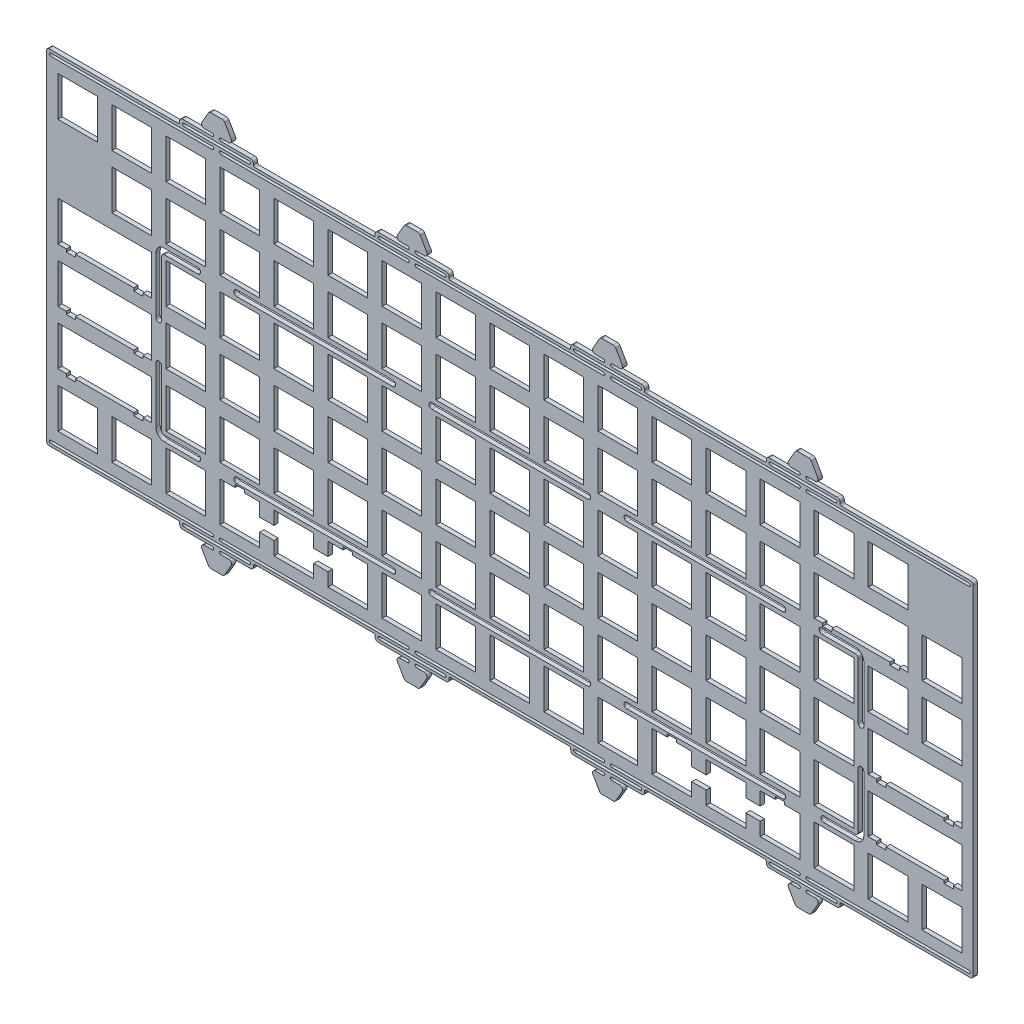
from build123d import *

# Parameters (mm, degrees)
SKETCH2_W           = 344.79935
SKETCH2_H           = 139.24936
SKETCH2_W_2         = 13.999
SKETCH2_H_2         = 14.00086
SKETCH2_W_3         = 14.001
SKETCH2_W_4         = 13.9993
SKETCH2_W_5         = 13.99955
SKETCH2_H_3         = 13.9994
SKETCH2_W_6         = 14.0007
SKETCH2_H_4         = 13.9993
SKETCH2_H_5         = 13.9992
BOSS_EXTRUDE1_DEPTH = 1.524
SKETCH3_W           = 388.73179045
SKETCH3_H           = 165.989329794
CUT_EXTRUDE1_DEPTH  = 186.935149558


with BuildPart() as part:
    # Sketch2 → Boss-Extrude1 (new body)
    with BuildSketch(Plane.XY):
        with Locations((-0.0007173, 0.0004735)):
            Rectangle(SKETCH2_W, SKETCH2_H)
        Polygon((102.2489577, -54.6242065), (102.2489577, -40.6233465), (96.8999577, -40.6233465), (96.8999577, -39.6545865), (93.5999577, -39.6545865), (93.5999577, -40.6233465), (88.2499577, -40.6233465), (88.2499577, -45.3238165), (83.1989577, -45.3238165), (83.1989577, -40.6233465), (69.1999577, -40.6233465), (69.1999577, -45.3238165), (64.1489577, -45.3238165), (64.1489577, -40.6233465), (58.8009577, -40.6233465), (58.8009577, -39.6545865), (55.4999577, -39.6545865), (55.4999577, -40.6233465), (50.1499577, -40.6233465), (50.1499577, -54.6242065), (64.1489577, -54.6242065), (64.1489577, -49.9223065), (69.1999577, -49.9223065), (69.1999577, -54.6242065), (83.1989577, -54.6242065), (83.1989577, -49.9223065), (88.2499577, -49.9223065), (88.2499577, -54.6242065), align=None, mode=Mode.SUBTRACT)
        Polygon((-50.1496423, -54.6242065), (-50.1496423, -40.6233465), (-55.4991423, -40.6233465), (-55.4991423, -39.6545865), (-58.7994423, -39.6545865), (-58.7994423, -40.6233465), (-64.1503423, -40.6233465), (-64.1503423, -45.3238165), (-69.2010423, -45.3238165), (-69.2010423, -40.6233465), (-83.2003423, -40.6233465), (-83.2003423, -45.3238165), (-88.2496423, -45.3238165), (-88.2496423, -40.6233465), (-93.6003423, -40.6233465), (-93.6003423, -39.6545865), (-96.9003423, -39.6545865), (-96.9003423, -40.6233465), (-102.2503423, -40.6233465), (-102.2503423, -54.6242065), (-88.2496423, -54.6242065), (-88.2496423, -49.9223065), (-83.2003423, -49.9223065), (-83.2003423, -54.6242065), (-69.2010423, -54.6242065), (-69.2010423, -49.9223065), (-64.1503423, -49.9223065), (-64.1503423, -54.6242065), align=None, mode=Mode.SUBTRACT)
        with Locations((152.3994577, -47.6237765)):
            Rectangle(SKETCH2_W_2, SKETCH2_H_2, mode=Mode.SUBTRACT)
        with Locations((133.3494577, -47.6237765)):
            Rectangle(SKETCH2_W_2, SKETCH2_H_2, mode=Mode.SUBTRACT)
        with Locations((114.2994577, -47.6237765)):
            Rectangle(SKETCH2_W_2, SKETCH2_H_2, mode=Mode.SUBTRACT)
        with Locations((38.0994577, -47.6237765)):
            Rectangle(SKETCH2_W_2, SKETCH2_H_2, mode=Mode.SUBTRACT)
        with Locations((19.0494577, -47.6237765)):
            Rectangle(SKETCH2_W_2, SKETCH2_H_2, mode=Mode.SUBTRACT)
        with Locations((-0.0005423, -47.6237765)):
            Rectangle(SKETCH2_W_2, SKETCH2_H_2, mode=Mode.SUBTRACT)
        with Locations((-19.0505423, -47.6237765)):
            Rectangle(SKETCH2_W_2, SKETCH2_H_2, mode=Mode.SUBTRACT)
        with Locations((-38.1015423, -47.6237765)):
            Rectangle(SKETCH2_W_3, SKETCH2_H_2, mode=Mode.SUBTRACT)
        with Locations((-114.3006923, -47.6237765)):
            Rectangle(SKETCH2_W_4, SKETCH2_H_2, mode=Mode.SUBTRACT)
        with Locations((-133.3506923, -47.6237765)):
            Rectangle(SKETCH2_W_4, SKETCH2_H_2, mode=Mode.SUBTRACT)
        with Locations((-152.4006173, -47.6237765)):
            Rectangle(SKETCH2_W_5, SKETCH2_H_2, mode=Mode.SUBTRACT)
        Polygon((126.3499577, -21.5748465), (126.3499577, -35.5742465), (129.3249577, -35.5742465), (129.3249577, -36.5443465), (132.6239577, -36.5443465), (132.6239577, -35.5742465), (153.1249577, -35.5742465), (153.1249577, -36.5443465), (156.4239577, -36.5443465), (156.4239577, -35.5742465), (159.3989577, -35.5742465), (159.3989577, -21.5748465), align=None, mode=Mode.SUBTRACT)
        Polygon((-159.4003923, -21.5748465), (-159.4003923, -35.5742465), (-156.4252023, -35.5742465), (-156.4252023, -36.5443465), (-153.1262023, -36.5443465), (-153.1262023, -35.5742465), (-132.6251423, -35.5742465), (-132.6251423, -36.5443465), (-129.3260423, -36.5443465), (-129.3260423, -35.5742465), (-126.3510423, -35.5742465), (-126.3510423, -21.5748465), align=None, mode=Mode.SUBTRACT)
        with Locations((114.2994577, -28.5745465)):
            Rectangle(SKETCH2_W_2, SKETCH2_H_3, mode=Mode.SUBTRACT)
        with Locations((95.2494577, -28.5745465)):
            Rectangle(SKETCH2_W_2, SKETCH2_H_3, mode=Mode.SUBTRACT)
        with Locations((76.1994577, -28.5745465)):
            Rectangle(SKETCH2_W_2, SKETCH2_H_3, mode=Mode.SUBTRACT)
        with Locations((57.1494577, -28.5745465)):
            Rectangle(SKETCH2_W_2, SKETCH2_H_3, mode=Mode.SUBTRACT)
        with Locations((38.0994577, -28.5745465)):
            Rectangle(SKETCH2_W_2, SKETCH2_H_3, mode=Mode.SUBTRACT)
        with Locations((19.0494577, -28.5745465)):
            Rectangle(SKETCH2_W_2, SKETCH2_H_3, mode=Mode.SUBTRACT)
        with Locations((-0.0005423, -28.5745465)):
            Rectangle(SKETCH2_W_2, SKETCH2_H_3, mode=Mode.SUBTRACT)
        with Locations((-19.0505423, -28.5745465)):
            Rectangle(SKETCH2_W_2, SKETCH2_H_3, mode=Mode.SUBTRACT)
        with Locations((-38.1015423, -28.5745465)):
            Rectangle(SKETCH2_W_3, SKETCH2_H_3, mode=Mode.SUBTRACT)
        with Locations((-57.1513923, -28.5745465)):
            Rectangle(SKETCH2_W_6, SKETCH2_H_3, mode=Mode.SUBTRACT)
        with Locations((-76.2006923, -28.5745465)):
            Rectangle(SKETCH2_W_4, SKETCH2_H_3, mode=Mode.SUBTRACT)
        with Locations((-95.2506923, -28.5745465)):
            Rectangle(SKETCH2_W_4, SKETCH2_H_3, mode=Mode.SUBTRACT)
        with Locations((-114.3006923, -28.5745465)):
            Rectangle(SKETCH2_W_4, SKETCH2_H_3, mode=Mode.SUBTRACT)
        Polygon((126.3499577, -2.5247465), (126.3499577, -16.5240465), (129.3249577, -16.5240465), (129.3249577, -17.4942465), (132.6239577, -17.4942465), (132.6239577, -16.5240465), (153.1249577, -16.5240465), (153.1249577, -17.4942465), (156.4239577, -17.4942465), (156.4239577, -16.5240465), (159.3989577, -16.5240465), (159.3989577, -2.5247465), align=None, mode=Mode.SUBTRACT)
        Polygon((-159.4003923, -2.5247465), (-159.4003923, -16.5240465), (-156.4252023, -16.5240465), (-156.4252023, -17.4942465), (-153.1262023, -17.4942465), (-153.1262023, -16.5240465), (-132.6251423, -16.5240465), (-132.6251423, -17.4942465), (-129.3260423, -17.4942465), (-129.3260423, -16.5240465), (-126.3510423, -16.5240465), (-126.3510423, -2.5247465), align=None, mode=Mode.SUBTRACT)
        with Locations((114.2994577, -9.5243965)):
            Rectangle(SKETCH2_W_2, SKETCH2_H_4, mode=Mode.SUBTRACT)
        with Locations((95.2494577, -9.5243965)):
            Rectangle(SKETCH2_W_2, SKETCH2_H_4, mode=Mode.SUBTRACT)
        with Locations((76.1994577, -9.5243965)):
            Rectangle(SKETCH2_W_2, SKETCH2_H_4, mode=Mode.SUBTRACT)
        with Locations((57.1494577, -9.5243965)):
            Rectangle(SKETCH2_W_2, SKETCH2_H_4, mode=Mode.SUBTRACT)
        with Locations((38.0994577, -9.5243965)):
            Rectangle(SKETCH2_W_2, SKETCH2_H_4, mode=Mode.SUBTRACT)
        with Locations((19.0494577, -9.5243965)):
            Rectangle(SKETCH2_W_2, SKETCH2_H_4, mode=Mode.SUBTRACT)
        with Locations((-0.0005423, -9.5243965)):
            Rectangle(SKETCH2_W_2, SKETCH2_H_4, mode=Mode.SUBTRACT)
        with Locations((-19.0505423, -9.5243965)):
            Rectangle(SKETCH2_W_2, SKETCH2_H_4, mode=Mode.SUBTRACT)
        with Locations((-38.1015423, -9.5243965)):
            Rectangle(SKETCH2_W_3, SKETCH2_H_4, mode=Mode.SUBTRACT)
        with Locations((-57.1513923, -9.5243965)):
            Rectangle(SKETCH2_W_6, SKETCH2_H_4, mode=Mode.SUBTRACT)
        with Locations((-76.2006923, -9.5243965)):
            Rectangle(SKETCH2_W_4, SKETCH2_H_4, mode=Mode.SUBTRACT)
        with Locations((-95.2506923, -9.5243965)):
            Rectangle(SKETCH2_W_4, SKETCH2_H_4, mode=Mode.SUBTRACT)
        with Locations((-114.3006923, -9.5243965)):
            Rectangle(SKETCH2_W_4, SKETCH2_H_4, mode=Mode.SUBTRACT)
        Polygon((-159.4003923, 16.5252535), (-159.4003923, 2.5259535), (-156.4252023, 2.5259535), (-156.4252023, 1.5557535), (-153.1262023, 1.5557535), (-153.1262023, 2.5259535), (-132.6251423, 2.5259535), (-132.6251423, 1.5557535), (-129.3260423, 1.5557535), (-129.3260423, 2.5259535), (-126.3510423, 2.5259535), (-126.3510423, 16.5252535), align=None, mode=Mode.SUBTRACT)
        with Locations((152.3994577, 9.5256035)):
            Rectangle(SKETCH2_W_2, SKETCH2_H_4, mode=Mode.SUBTRACT)
        with Locations((133.3494577, 9.5256035)):
            Rectangle(SKETCH2_W_2, SKETCH2_H_4, mode=Mode.SUBTRACT)
        with Locations((114.2994577, 9.5256035)):
            Rectangle(SKETCH2_W_2, SKETCH2_H_4, mode=Mode.SUBTRACT)
        with Locations((95.2494577, 9.5256035)):
            Rectangle(SKETCH2_W_2, SKETCH2_H_4, mode=Mode.SUBTRACT)
        with Locations((76.1994577, 9.5256035)):
            Rectangle(SKETCH2_W_2, SKETCH2_H_4, mode=Mode.SUBTRACT)
        with Locations((57.1494577, 9.5256035)):
            Rectangle(SKETCH2_W_2, SKETCH2_H_4, mode=Mode.SUBTRACT)
        with Locations((38.0994577, 9.5256035)):
            Rectangle(SKETCH2_W_2, SKETCH2_H_4, mode=Mode.SUBTRACT)
        with Locations((19.0494577, 9.5256035)):
            Rectangle(SKETCH2_W_2, SKETCH2_H_4, mode=Mode.SUBTRACT)
        with Locations((-0.0005423, 9.5256035)):
            Rectangle(SKETCH2_W_2, SKETCH2_H_4, mode=Mode.SUBTRACT)
        with Locations((-19.0505423, 9.5256035)):
            Rectangle(SKETCH2_W_2, SKETCH2_H_4, mode=Mode.SUBTRACT)
        with Locations((-38.1015423, 9.5256035)):
            Rectangle(SKETCH2_W_3, SKETCH2_H_4, mode=Mode.SUBTRACT)
        with Locations((-57.1513923, 9.5256035)):
            Rectangle(SKETCH2_W_6, SKETCH2_H_4, mode=Mode.SUBTRACT)
        with Locations((-76.2006923, 9.5256035)):
            Rectangle(SKETCH2_W_4, SKETCH2_H_4, mode=Mode.SUBTRACT)
        with Locations((-95.2506923, 9.5256035)):
            Rectangle(SKETCH2_W_4, SKETCH2_H_4, mode=Mode.SUBTRACT)
        with Locations((-114.3006923, 9.5256035)):
            Rectangle(SKETCH2_W_4, SKETCH2_H_4, mode=Mode.SUBTRACT)
        Polygon((107.2999577, 35.5752535), (107.2999577, 21.5759535), (110.2749577, 21.5759535), (110.2749577, 20.6057535), (113.5739577, 20.6057535), (113.5739577, 21.5759535), (134.0749577, 21.5759535), (134.0749577, 20.6057535), (137.3739577, 20.6057535), (137.3739577, 21.5759535), (140.3489577, 21.5759535), (140.3489577, 35.5752535), align=None, mode=Mode.SUBTRACT)
        with Locations((152.3994577, 28.5756035)):
            Rectangle(SKETCH2_W_2, SKETCH2_H_4, mode=Mode.SUBTRACT)
        with Locations((95.2494577, 28.5756035)):
            Rectangle(SKETCH2_W_2, SKETCH2_H_4, mode=Mode.SUBTRACT)
        with Locations((76.1994577, 28.5756035)):
            Rectangle(SKETCH2_W_2, SKETCH2_H_4, mode=Mode.SUBTRACT)
        with Locations((57.1494577, 28.5756035)):
            Rectangle(SKETCH2_W_2, SKETCH2_H_4, mode=Mode.SUBTRACT)
        with Locations((38.0994577, 28.5756035)):
            Rectangle(SKETCH2_W_2, SKETCH2_H_4, mode=Mode.SUBTRACT)
        with Locations((19.0494577, 28.5756035)):
            Rectangle(SKETCH2_W_2, SKETCH2_H_4, mode=Mode.SUBTRACT)
        with Locations((-0.0005423, 28.5756035)):
            Rectangle(SKETCH2_W_2, SKETCH2_H_4, mode=Mode.SUBTRACT)
        with Locations((-19.0505423, 28.5756035)):
            Rectangle(SKETCH2_W_2, SKETCH2_H_4, mode=Mode.SUBTRACT)
        with Locations((-38.1015423, 28.5756035)):
            Rectangle(SKETCH2_W_3, SKETCH2_H_4, mode=Mode.SUBTRACT)
        with Locations((-57.1513923, 28.5756035)):
            Rectangle(SKETCH2_W_6, SKETCH2_H_4, mode=Mode.SUBTRACT)
        with Locations((-76.2006923, 28.5756035)):
            Rectangle(SKETCH2_W_4, SKETCH2_H_4, mode=Mode.SUBTRACT)
        with Locations((-95.2506923, 28.5756035)):
            Rectangle(SKETCH2_W_4, SKETCH2_H_4, mode=Mode.SUBTRACT)
        with Locations((-114.3006923, 28.5756035)):
            Rectangle(SKETCH2_W_4, SKETCH2_H_4, mode=Mode.SUBTRACT)
        with Locations((-133.3506923, 28.5756035)):
            Rectangle(SKETCH2_W_4, SKETCH2_H_4, mode=Mode.SUBTRACT)
        with Locations((133.3494577, 47.6255535)):
            Rectangle(SKETCH2_W_2, SKETCH2_H_5, mode=Mode.SUBTRACT)
        with Locations((114.2994577, 47.6255535)):
            Rectangle(SKETCH2_W_2, SKETCH2_H_5, mode=Mode.SUBTRACT)
        with Locations((95.2494577, 47.6255535)):
            Rectangle(SKETCH2_W_2, SKETCH2_H_5, mode=Mode.SUBTRACT)
        with Locations((76.1994577, 47.6255535)):
            Rectangle(SKETCH2_W_2, SKETCH2_H_5, mode=Mode.SUBTRACT)
        with Locations((57.1494577, 47.6255535)):
            Rectangle(SKETCH2_W_2, SKETCH2_H_5, mode=Mode.SUBTRACT)
        with Locations((38.0994577, 47.6255535)):
            Rectangle(SKETCH2_W_2, SKETCH2_H_5, mode=Mode.SUBTRACT)
        with Locations((19.0494577, 47.6255535)):
            Rectangle(SKETCH2_W_2, SKETCH2_H_5, mode=Mode.SUBTRACT)
        with Locations((-0.0005423, 47.6255535)):
            Rectangle(SKETCH2_W_2, SKETCH2_H_5, mode=Mode.SUBTRACT)
        with Locations((-19.0505423, 47.6255535)):
            Rectangle(SKETCH2_W_2, SKETCH2_H_5, mode=Mode.SUBTRACT)
        with Locations((-38.1015423, 47.6255535)):
            Rectangle(SKETCH2_W_3, SKETCH2_H_5, mode=Mode.SUBTRACT)
        with Locations((-57.1513923, 47.6255535)):
            Rectangle(SKETCH2_W_6, SKETCH2_H_5, mode=Mode.SUBTRACT)
        with Locations((-76.2006923, 47.6255535)):
            Rectangle(SKETCH2_W_4, SKETCH2_H_5, mode=Mode.SUBTRACT)
        with Locations((-95.2506923, 47.6255535)):
            Rectangle(SKETCH2_W_4, SKETCH2_H_5, mode=Mode.SUBTRACT)
        with Locations((-114.3006923, 47.6255535)):
            Rectangle(SKETCH2_W_4, SKETCH2_H_5, mode=Mode.SUBTRACT)
        with Locations((-133.3506923, 47.6255535)):
            Rectangle(SKETCH2_W_4, SKETCH2_H_5, mode=Mode.SUBTRACT)
        with Locations((-152.4006173, 47.6255535)):
            Rectangle(SKETCH2_W_5, SKETCH2_H_5, mode=Mode.SUBTRACT)
    extrude(amount=BOSS_EXTRUDE1_DEPTH)

    # Sketch3 → Cut-Extrude1 (cut, through all)
    # profile 1 of 29: a face of its own
    with BuildSketch(Plane.XY.offset(1.524)):
        Rectangle(SKETCH3_W, SKETCH3_H)
        with BuildLine():
            ThreePointArc((-105.4405223, -69.6242065), (-105.9405223, -69.490231904), (-106.306547704, -69.1242065))
            Line((-106.306547704, -69.1242065), (-108.615948781, -65.1242065))
            ThreePointArc((-108.615948781, -65.1242065), (-108.615948781, -64.1242065), (-107.749923377, -63.6242065))
            Line((-107.749923377, -63.6242065), (-104.9405223, -63.6242065))
            ThreePointArc((-104.9405223, -63.6242065), (-104.4405223, -63.1242065), (-104.9405223, -62.6242065))
            Line((-104.9405223, -62.6242065), (-115.4405223, -62.6242065))
            ThreePointArc((-115.4405223, -62.6242065), (-116.147629081, -62.331313281), (-116.4405223, -61.6242065))
            Line((-116.4405223, -61.6242065), (-116.4405223, -61.1241965))
            ThreePointArc((-116.4405223, -61.1241965), (-116.58696598, -60.77065018), (-116.9405123, -60.6242065))
            Line((-116.9405123, -60.6242065), (-162.4003923, -60.6242065))
            ThreePointArc((-162.4003923, -60.6242065), (-163.107499081, -60.331313281), (-163.4003923, -59.6242065))
            Line((-163.4003923, -59.6242065), (-163.4003923, 59.6242065))
            ThreePointArc((-163.4003923, 59.6242065), (-163.107499081, 60.331313281), (-162.4003923, 60.6242065))
            Line((-162.4003923, 60.6242065), (-116.9405123, 60.6242065))
            ThreePointArc((-116.9405123, 60.6242065), (-116.58696598, 60.77065018), (-116.4405223, 61.1241965))
            Line((-116.4405223, 61.1241965), (-116.4405223, 61.6242065))
            ThreePointArc((-116.4405223, 61.6242065), (-116.147629081, 62.331313281), (-115.4405223, 62.6242065))
            Line((-115.4405223, 62.6242065), (-104.9405223, 62.6242065))
            ThreePointArc((-104.9405223, 62.6242065), (-104.4405223, 63.1242065), (-104.9405223, 63.6242065))
            Line((-104.9405223, 63.6242065), (-107.749923377, 63.6242065))
            ThreePointArc((-107.749923377, 63.6242065), (-108.615948781, 64.1242065), (-108.615948781, 65.1242065))
            Line((-108.615948781, 65.1242065), (-106.306547704, 69.1242065))
            ThreePointArc((-106.306547704, 69.1242065), (-105.9405223, 69.490231904), (-105.4405223, 69.6242065))
            Line((-105.4405223, 69.6242065), (-101.4405223, 69.6242065))
            ThreePointArc((-101.4405223, 69.6242065), (-100.9405223, 69.490231904), (-100.574496896, 69.1242065))
            Line((-100.574496896, 69.1242065), (-98.265095819, 65.1242065))
            ThreePointArc((-98.265095819, 65.1242065), (-98.265095819, 64.1242065), (-99.131121223, 63.6242065))
            Line((-99.131121223, 63.6242065), (-101.9405223, 63.6242065))
            ThreePointArc((-101.9405223, 63.6242065), (-102.4405223, 63.1242065), (-101.9405223, 62.6242065))
            Line((-101.9405223, 62.6242065), (-91.4405223, 62.6242065))
            ThreePointArc((-91.4405223, 62.6242065), (-90.733415519, 62.331313281), (-90.4405223, 61.6242065))
            Line((-90.4405223, 61.6242065), (-90.4405223, 61.1241965))
            ThreePointArc((-90.4405223, 61.1241965), (-90.29407862, 60.77065018), (-89.9405323, 60.6242065))
            Line((-89.9405323, 60.6242065), (-47.9806423, 60.6242065))
            ThreePointArc((-47.9806423, 60.6242065), (-47.62709598, 60.77065018), (-47.4806523, 61.1241965))
            Line((-47.4806523, 61.1241965), (-47.4806523, 61.6242065))
            ThreePointArc((-47.4806523, 61.6242065), (-47.187759081, 62.331313281), (-46.4806523, 62.6242065))
            Line((-46.4806523, 62.6242065), (-35.9806523, 62.6242065))
            ThreePointArc((-35.9806523, 62.6242065), (-35.4806523, 63.1242065), (-35.9806523, 63.6242065))
            Line((-35.9806523, 63.6242065), (-38.790053377, 63.6242065))
            ThreePointArc((-38.790053377, 63.6242065), (-39.656078781, 64.1242065), (-39.656078781, 65.1242065))
            Line((-39.656078781, 65.1242065), (-37.346677704, 69.1242065))
            ThreePointArc((-37.346677704, 69.1242065), (-36.9806523, 69.490231904), (-36.4806523, 69.6242065))
            Line((-36.4806523, 69.6242065), (-32.4806523, 69.6242065))
            ThreePointArc((-32.4806523, 69.6242065), (-31.9806523, 69.490231904), (-31.614626896, 69.1242065))
            Line((-31.614626896, 69.1242065), (-29.305225819, 65.1242065))
            ThreePointArc((-29.305225819, 65.1242065), (-29.305225819, 64.1242065), (-30.171251223, 63.6242065))
            Line((-30.171251223, 63.6242065), (-32.9806523, 63.6242065))
            ThreePointArc((-32.9806523, 63.6242065), (-33.4806523, 63.1242065), (-32.9806523, 62.6242065))
            Line((-32.9806523, 62.6242065), (-22.4806523, 62.6242065))
            ThreePointArc((-22.4806523, 62.6242065), (-21.773545519, 62.331313281), (-21.4806523, 61.6242065))
            Line((-21.4806523, 61.6242065), (-21.4806523, 61.1241965))
            ThreePointArc((-21.4806523, 61.1241965), (-21.33420862, 60.77065018), (-20.9806623, 60.6242065))
            Line((-20.9806623, 60.6242065), (20.9792277, 60.6242065))
            ThreePointArc((20.9792277, 60.6242065), (21.33277402, 60.77065018), (21.4792177, 61.1241965))
            Line((21.4792177, 61.1241965), (21.4792177, 61.6242065))
            ThreePointArc((21.4792177, 61.6242065), (21.772110919, 62.331313281), (22.4792177, 62.6242065))
            Line((22.4792177, 62.6242065), (32.9792177, 62.6242065))
            ThreePointArc((32.9792177, 62.6242065), (33.4792177, 63.1242065), (32.9792177, 63.6242065))
            Line((32.9792177, 63.6242065), (30.169816623, 63.6242065))
            ThreePointArc((30.169816623, 63.6242065), (29.303791219, 64.1242065), (29.303791219, 65.1242065))
            Line((29.303791219, 65.1242065), (31.613192296, 69.1242065))
            ThreePointArc((31.613192296, 69.1242065), (31.9792177, 69.490231904), (32.4792177, 69.6242065))
            Line((32.4792177, 69.6242065), (36.4792177, 69.6242065))
            ThreePointArc((36.4792177, 69.6242065), (36.9792177, 69.490231904), (37.345243104, 69.1242065))
            Line((37.345243104, 69.1242065), (39.654644181, 65.1242065))
            ThreePointArc((39.654644181, 65.1242065), (39.654644181, 64.1242065), (38.788618777, 63.6242065))
            Line((38.788618777, 63.6242065), (35.9792177, 63.6242065))
            ThreePointArc((35.9792177, 63.6242065), (35.4792177, 63.1242065), (35.9792177, 62.6242065))
            Line((35.9792177, 62.6242065), (46.4792177, 62.6242065))
            ThreePointArc((46.4792177, 62.6242065), (47.186324481, 62.331313281), (47.4792177, 61.6242065))
            Line((47.4792177, 61.6242065), (47.4792177, 61.1241965))
            ThreePointArc((47.4792177, 61.1241965), (47.62566138, 60.77065018), (47.9792077, 60.6242065))
            Line((47.9792077, 60.6242065), (89.9390977, 60.6242065))
            ThreePointArc((89.9390977, 60.6242065), (90.29264402, 60.77065018), (90.4390877, 61.1241965))
            Line((90.4390877, 61.1241965), (90.4390877, 61.6242065))
            ThreePointArc((90.4390877, 61.6242065), (90.731980919, 62.331313281), (91.4390877, 62.6242065))
            Line((91.4390877, 62.6242065), (101.9390877, 62.6242065))
            ThreePointArc((101.9390877, 62.6242065), (102.4390877, 63.1242065), (101.9390877, 63.6242065))
            Line((101.9390877, 63.6242065), (99.129686623, 63.6242065))
            ThreePointArc((99.129686623, 63.6242065), (98.263661219, 64.1242065), (98.263661219, 65.1242065))
            Line((98.263661219, 65.1242065), (100.573062296, 69.1242065))
            ThreePointArc((100.573062296, 69.1242065), (100.9390877, 69.490231904), (101.4390877, 69.6242065))
            Line((101.4390877, 69.6242065), (105.4390877, 69.6242065))
            ThreePointArc((105.4390877, 69.6242065), (105.9390877, 69.490231904), (106.305113104, 69.1242065))
            Line((106.305113104, 69.1242065), (108.614514181, 65.1242065))
            ThreePointArc((108.614514181, 65.1242065), (108.614514181, 64.1242065), (107.748488777, 63.6242065))
            Line((107.748488777, 63.6242065), (104.9390877, 63.6242065))
            ThreePointArc((104.9390877, 63.6242065), (104.4390877, 63.1242065), (104.9390877, 62.6242065))
            Line((104.9390877, 62.6242065), (115.4390877, 62.6242065))
            ThreePointArc((115.4390877, 62.6242065), (116.146194481, 62.331313281), (116.4390877, 61.6242065))
            Line((116.4390877, 61.6242065), (116.4390877, 61.1241965))
            ThreePointArc((116.4390877, 61.1241965), (116.58553138, 60.77065018), (116.9390777, 60.6242065))
            Line((116.9390777, 60.6242065), (162.3989577, 60.6242065))
            ThreePointArc((162.3989577, 60.6242065), (163.106064481, 60.331313281), (163.3989577, 59.6242065))
            Line((163.3989577, 59.6242065), (163.3989577, -59.6242065))
            ThreePointArc((163.3989577, -59.6242065), (163.106064481, -60.331313281), (162.3989577, -60.6242065))
            Line((162.3989577, -60.6242065), (116.9390777, -60.6242065))
            ThreePointArc((116.9390777, -60.6242065), (116.58553138, -60.77065018), (116.4390877, -61.1241965))
            Line((116.4390877, -61.1241965), (116.4390877, -61.6242065))
            ThreePointArc((116.4390877, -61.6242065), (116.146194481, -62.331313281), (115.4390877, -62.6242065))
            Line((115.4390877, -62.6242065), (104.9390877, -62.6242065))
            ThreePointArc((104.9390877, -62.6242065), (104.4390877, -63.1242065), (104.9390877, -63.6242065))
            Line((104.9390877, -63.6242065), (107.748488777, -63.6242065))
            ThreePointArc((107.748488777, -63.6242065), (108.614514181, -64.1242065), (108.614514181, -65.1242065))
            Line((108.614514181, -65.1242065), (106.305113104, -69.1242065))
            ThreePointArc((106.305113104, -69.1242065), (105.9390877, -69.490231904), (105.4390877, -69.6242065))
            Line((105.4390877, -69.6242065), (101.4390877, -69.6242065))
            ThreePointArc((101.4390877, -69.6242065), (100.9390877, -69.490231904), (100.573062296, -69.1242065))
            Line((100.573062296, -69.1242065), (98.263661219, -65.1242065))
            ThreePointArc((98.263661219, -65.1242065), (98.263661219, -64.1242065), (99.129686623, -63.6242065))
            Line((99.129686623, -63.6242065), (101.9390877, -63.6242065))
            ThreePointArc((101.9390877, -63.6242065), (102.4390877, -63.1242065), (101.9390877, -62.6242065))
            Line((101.9390877, -62.6242065), (91.4390877, -62.6242065))
            ThreePointArc((91.4390877, -62.6242065), (90.731980919, -62.331313281), (90.4390877, -61.6242065))
            Line((90.4390877, -61.6242065), (90.4390877, -61.1241965))
            ThreePointArc((90.4390877, -61.1241965), (90.29264402, -60.77065018), (89.9390977, -60.6242065))
            Line((89.9390977, -60.6242065), (47.9792077, -60.6242065))
            ThreePointArc((47.9792077, -60.6242065), (47.62566138, -60.77065018), (47.4792177, -61.1241965))
            Line((47.4792177, -61.1241965), (47.4792177, -61.6242065))
            ThreePointArc((47.4792177, -61.6242065), (47.186324481, -62.331313281), (46.4792177, -62.6242065))
            Line((46.4792177, -62.6242065), (35.9792177, -62.6242065))
            ThreePointArc((35.9792177, -62.6242065), (35.4792177, -63.1242065), (35.9792177, -63.6242065))
            Line((35.9792177, -63.6242065), (38.788618777, -63.6242065))
            ThreePointArc((38.788618777, -63.6242065), (39.654644181, -64.1242065), (39.654644181, -65.1242065))
            Line((39.654644181, -65.1242065), (37.345243104, -69.1242065))
            ThreePointArc((37.345243104, -69.1242065), (36.9792177, -69.490231904), (36.4792177, -69.6242065))
            Line((36.4792177, -69.6242065), (32.4792177, -69.6242065))
            ThreePointArc((32.4792177, -69.6242065), (31.9792177, -69.490231904), (31.613192296, -69.1242065))
            Line((31.613192296, -69.1242065), (29.303791219, -65.1242065))
            ThreePointArc((29.303791219, -65.1242065), (29.303791219, -64.1242065), (30.169816623, -63.6242065))
            Line((30.169816623, -63.6242065), (32.9792177, -63.6242065))
            ThreePointArc((32.9792177, -63.6242065), (33.4792177, -63.1242065), (32.9792177, -62.6242065))
            Line((32.9792177, -62.6242065), (22.4792177, -62.6242065))
            ThreePointArc((22.4792177, -62.6242065), (21.772110919, -62.331313281), (21.4792177, -61.6242065))
            Line((21.4792177, -61.6242065), (21.4792177, -61.1241965))
            ThreePointArc((21.4792177, -61.1241965), (21.33277402, -60.77065018), (20.9792277, -60.6242065))
            Line((20.9792277, -60.6242065), (-20.9806623, -60.6242065))
            ThreePointArc((-20.9806623, -60.6242065), (-21.33420862, -60.77065018), (-21.4806523, -61.1241965))
            Line((-21.4806523, -61.1241965), (-21.4806523, -61.6242065))
            ThreePointArc((-21.4806523, -61.6242065), (-21.773545519, -62.331313281), (-22.4806523, -62.6242065))
            Line((-22.4806523, -62.6242065), (-32.9806523, -62.6242065))
            ThreePointArc((-32.9806523, -62.6242065), (-33.4806523, -63.1242065), (-32.9806523, -63.6242065))
            Line((-32.9806523, -63.6242065), (-30.171251223, -63.6242065))
            ThreePointArc((-30.171251223, -63.6242065), (-29.305225819, -64.1242065), (-29.305225819, -65.1242065))
            Line((-29.305225819, -65.1242065), (-31.614626896, -69.1242065))
            ThreePointArc((-31.614626896, -69.1242065), (-31.9806523, -69.490231904), (-32.4806523, -69.6242065))
            Line((-32.4806523, -69.6242065), (-36.4806523, -69.6242065))
            ThreePointArc((-36.4806523, -69.6242065), (-36.9806523, -69.490231904), (-37.346677704, -69.1242065))
            Line((-37.346677704, -69.1242065), (-39.656078781, -65.1242065))
            ThreePointArc((-39.656078781, -65.1242065), (-39.656078781, -64.1242065), (-38.790053377, -63.6242065))
            Line((-38.790053377, -63.6242065), (-35.9806523, -63.6242065))
            ThreePointArc((-35.9806523, -63.6242065), (-35.4806523, -63.1242065), (-35.9806523, -62.6242065))
            Line((-35.9806523, -62.6242065), (-46.4806523, -62.6242065))
            ThreePointArc((-46.4806523, -62.6242065), (-47.187759081, -62.331313281), (-47.4806523, -61.6242065))
            Line((-47.4806523, -61.6242065), (-47.4806523, -61.1241965))
            ThreePointArc((-47.4806523, -61.1241965), (-47.62709598, -60.77065018), (-47.9806423, -60.6242065))
            Line((-47.9806423, -60.6242065), (-89.9405323, -60.6242065))
            ThreePointArc((-89.9405323, -60.6242065), (-90.29407862, -60.77065018), (-90.4405223, -61.1241965))
            Line((-90.4405223, -61.1241965), (-90.4405223, -61.6242065))
            ThreePointArc((-90.4405223, -61.6242065), (-90.733415519, -62.331313281), (-91.4405223, -62.6242065))
            Line((-91.4405223, -62.6242065), (-101.9405223, -62.6242065))
            ThreePointArc((-101.9405223, -62.6242065), (-102.4405223, -63.1242065), (-101.9405223, -63.6242065))
            Line((-101.9405223, -63.6242065), (-99.131121223, -63.6242065))
            ThreePointArc((-99.131121223, -63.6242065), (-98.265095819, -64.1242065), (-98.265095819, -65.1242065))
            Line((-98.265095819, -65.1242065), (-100.574496896, -69.1242065))
            ThreePointArc((-100.574496896, -69.1242065), (-100.9405223, -69.490231904), (-101.4405223, -69.6242065))
            Line((-101.4405223, -69.6242065), (-105.4405223, -69.6242065))
        make_face(mode=Mode.SUBTRACT)
    # profile 2 of 29: a face of its own
    with BuildSketch(Plane.XY.offset(1.524)):
        with BuildLine():
            Line((110.066116033, 18.0506035), (121.8244577, 18.0506035))
            ThreePointArc((121.8244577, 18.0506035), (122.531564481, 17.757710281), (122.8244577, 17.0506035))
            Line((122.8244577, 17.0506035), (122.8244577, -2.6440965))
            ThreePointArc((122.8244577, -2.6440965), (123.8244577, -3.6440965), (124.8244577, -2.6440965))
            Line((124.8244577, -2.6440965), (124.8244577, 17.0506035))
            ThreePointArc((124.8244577, 17.0506035), (123.945778044, 19.171923844), (121.8244577, 20.0506035))
            Line((121.8244577, 20.0506035), (110.066116033, 20.0506035))
            ThreePointArc((110.066116033, 20.0506035), (109.066116033, 19.0506035), (110.066116033, 18.0506035))
        make_face()
    # profile 3 of 29: a face of its own
    with BuildSketch(Plane.XY.offset(1.524)):
        with BuildLine():
            ThreePointArc((110.718180633, -37.0987965), (109.718180633, -38.0987965), (110.718180633, -39.0987965))
            Line((110.718180633, -39.0987965), (121.8244577, -39.0987965))
            ThreePointArc((121.8244577, -39.0987965), (123.945778044, -38.220116844), (124.8244577, -36.0987965))
            Line((124.8244577, -36.0987965), (124.8244577, -16.4040965))
            ThreePointArc((124.8244577, -16.4040965), (123.8244577, -15.4040965), (122.8244577, -16.4040965))
            Line((122.8244577, -16.4040965), (122.8244577, -36.0987965))
            ThreePointArc((122.8244577, -36.0987965), (122.531564481, -36.805903281), (121.8244577, -37.0987965))
            Line((121.8244577, -37.0987965), (110.718180633, -37.0987965))
        make_face()
    # profile 4 of 29: a face of its own
    with BuildSketch(Plane.XY.offset(1.524)):
        with BuildLine():
            ThreePointArc((-110.067350633, 18.0506035), (-109.067350633, 19.0506035), (-110.067350633, 20.0506035))
            Line((-110.067350633, 20.0506035), (-121.8256923, 20.0506035))
            ThreePointArc((-121.8256923, 20.0506035), (-123.947012644, 19.171923844), (-124.8256923, 17.0506035))
            Line((-124.8256923, 17.0506035), (-124.8256923, -2.6440965))
            ThreePointArc((-124.8256923, -2.6440965), (-123.8256923, -3.6440965), (-122.8256923, -2.6440965))
            Line((-122.8256923, -2.6440965), (-122.8256923, 17.0506035))
            ThreePointArc((-122.8256923, 17.0506035), (-122.532799081, 17.757710281), (-121.8256923, 18.0506035))
            Line((-121.8256923, 18.0506035), (-110.067350633, 18.0506035))
        make_face()
    # profile 5 of 29: a face of its own
    with BuildSketch(Plane.XY.offset(1.524)):
        with BuildLine():
            ThreePointArc((41.2744077, -37.0987965), (40.2744077, -38.0987965), (41.2744077, -39.0987965))
            Line((41.2744077, -39.0987965), (96.307774367, -39.0987965))
            ThreePointArc((96.307774367, -39.0987965), (97.307774367, -38.0987965), (96.307774367, -37.0987965))
            Line((96.307774367, -37.0987965), (41.2744077, -37.0987965))
        make_face()
    # profile 6 of 29: a face of its own
    with BuildSketch(Plane.XY.offset(1.524)):
        with BuildLine():
            ThreePointArc((-27.517300633, -37.0987965), (-28.517300633, -38.0987965), (-27.517300633, -39.0987965))
            Line((-27.517300633, -39.0987965), (27.516066033, -39.0987965))
            ThreePointArc((27.516066033, -39.0987965), (28.516066033, -38.0987965), (27.516066033, -37.0987965))
            Line((27.516066033, -37.0987965), (-27.517300633, -37.0987965))
        make_face()
    # profile 7 of 29: a face of its own
    with BuildSketch(Plane.XY.offset(1.524)):
        with BuildLine():
            ThreePointArc((-96.309008967, -37.0987965), (-97.309008967, -38.0987965), (-96.309008967, -39.0987965))
            Line((-96.309008967, -39.0987965), (-41.2756423, -39.0987965))
            ThreePointArc((-41.2756423, -39.0987965), (-40.2756423, -38.0987965), (-41.2756423, -37.0987965))
            Line((-41.2756423, -37.0987965), (-96.309008967, -37.0987965))
        make_face()
    # profile 8 of 29: a face of its own
    with BuildSketch(Plane.XY.offset(1.524)):
        with BuildLine():
            ThreePointArc((41.2744077, 20.0506035), (40.2744077, 19.0506035), (41.2744077, 18.0506035))
            Line((41.2744077, 18.0506035), (96.307774367, 18.0506035))
            ThreePointArc((96.307774367, 18.0506035), (97.307774367, 19.0506035), (96.307774367, 20.0506035))
            Line((96.307774367, 20.0506035), (41.2744077, 20.0506035))
        make_face()
    # profile 9 of 29: a face of its own
    with BuildSketch(Plane.XY.offset(1.524)):
        with BuildLine():
            ThreePointArc((-96.309008967, 20.0506035), (-97.309008967, 19.0506035), (-96.309008967, 18.0506035))
            Line((-96.309008967, 18.0506035), (-41.2756423, 18.0506035))
            ThreePointArc((-41.2756423, 18.0506035), (-40.2756423, 19.0506035), (-41.2756423, 20.0506035))
            Line((-41.2756423, 20.0506035), (-96.309008967, 20.0506035))
        make_face()
    # profile 10 of 29: a face of its own
    with BuildSketch(Plane.XY.offset(1.524)):
        with BuildLine():
            ThreePointArc((-27.517300633, 20.0506035), (-28.517300633, 19.0506035), (-27.517300633, 18.0506035))
            Line((-27.517300633, 18.0506035), (27.516066033, 18.0506035))
            ThreePointArc((27.516066033, 18.0506035), (28.516066033, 19.0506035), (27.516066033, 20.0506035))
            Line((27.516066033, 20.0506035), (-27.517300633, 20.0506035))
        make_face()
    # profile 11 of 29: a face of its own
    with BuildSketch(Plane.XY.offset(1.524)):
        with BuildLine():
            Line((-110.067350633, -37.0987965), (-121.8256923, -37.0987965))
            ThreePointArc((-121.8256923, -37.0987965), (-122.532799081, -36.805903281), (-122.8256923, -36.0987965))
            Line((-122.8256923, -36.0987965), (-122.8256923, -16.4040965))
            ThreePointArc((-122.8256923, -16.4040965), (-123.8256923, -15.4040965), (-124.8256923, -16.4040965))
            Line((-124.8256923, -16.4040965), (-124.8256923, -36.0987965))
            ThreePointArc((-124.8256923, -36.0987965), (-123.947012644, -38.220116844), (-121.8256923, -39.0987965))
            Line((-121.8256923, -39.0987965), (-110.067350633, -39.0987965))
            ThreePointArc((-110.067350633, -39.0987965), (-109.067350633, -38.0987965), (-110.067350633, -37.0987965))
        make_face()
    # profile 12 of 29: a face of its own
    with BuildSketch(Plane.XY.offset(1.524)):
        with BuildLine():
            ThreePointArc((-161.90456195, 59.6242065), (-162.40456195, 59.1242065), (-161.90456195, 58.6242065))
            Line((-161.90456195, 58.6242065), (-104.9405223, 58.6242065))
            ThreePointArc((-104.9405223, 58.6242065), (-104.4405223, 59.1242065), (-104.9405223, 59.6242065))
            Line((-104.9405223, 59.6242065), (-161.90456195, 59.6242065))
        make_face()
    # profile 13 of 29: a face of its own
    with BuildSketch(Plane.XY.offset(1.524)):
        with BuildLine():
            ThreePointArc((-101.9405223, 59.6242065), (-102.4405223, 59.1242065), (-101.9405223, 58.6242065))
            Line((-101.9405223, 58.6242065), (-35.9806523, 58.6242065))
            ThreePointArc((-35.9806523, 58.6242065), (-35.4806523, 59.1242065), (-35.9806523, 59.6242065))
            Line((-35.9806523, 59.6242065), (-101.9405223, 59.6242065))
        make_face()
    # profile 14 of 29: a face of its own
    with BuildSketch(Plane.XY.offset(1.524)):
        with BuildLine():
            Line((32.9792177, 59.6242065), (-32.9806523, 59.6242065))
            ThreePointArc((-32.9806523, 59.6242065), (-33.4806523, 59.1242065), (-32.9806523, 58.6242065))
            Line((-32.9806523, 58.6242065), (32.9792177, 58.6242065))
            ThreePointArc((32.9792177, 58.6242065), (33.4792177, 59.1242065), (32.9792177, 59.6242065))
        make_face()
    # profile 15 of 29: a face of its own
    with BuildSketch(Plane.XY.offset(1.524)):
        with BuildLine():
            Line((101.9390877, 59.6242065), (35.9792177, 59.6242065))
            ThreePointArc((35.9792177, 59.6242065), (35.4792177, 59.1242065), (35.9792177, 58.6242065))
            Line((35.9792177, 58.6242065), (101.9390877, 58.6242065))
            ThreePointArc((101.9390877, 58.6242065), (102.4390877, 59.1242065), (101.9390877, 59.6242065))
        make_face()
    # profile 16 of 29: a face of its own
    with BuildSketch(Plane.XY.offset(1.524)):
        with BuildLine():
            ThreePointArc((161.90312735, 58.6242065), (162.40312735, 59.1242065), (161.90312735, 59.6242065))
            Line((161.90312735, 59.6242065), (104.9390877, 59.6242065))
            ThreePointArc((104.9390877, 59.6242065), (104.4390877, 59.1242065), (104.9390877, 58.6242065))
            Line((104.9390877, 58.6242065), (161.90312735, 58.6242065))
        make_face()
    # profile 17 of 29: a face of its own
    with BuildSketch(Plane.XY.offset(1.524)):
        with BuildLine():
            ThreePointArc((161.90312735, -59.6242065), (162.40312735, -59.1242065), (161.90312735, -58.6242065))
            Line((161.90312735, -58.6242065), (104.9390877, -58.6242065))
            ThreePointArc((104.9390877, -58.6242065), (104.4390877, -59.1242065), (104.9390877, -59.6242065))
            Line((104.9390877, -59.6242065), (161.90312735, -59.6242065))
        make_face()
    # profile 18 of 29: a face of its own
    with BuildSketch(Plane.XY.offset(1.524)):
        with BuildLine():
            ThreePointArc((-161.90456195, -58.6242065), (-162.40456195, -59.1242065), (-161.90456195, -59.6242065))
            Line((-161.90456195, -59.6242065), (-104.9405223, -59.6242065))
            ThreePointArc((-104.9405223, -59.6242065), (-104.4405223, -59.1242065), (-104.9405223, -58.6242065))
            Line((-104.9405223, -58.6242065), (-161.90456195, -58.6242065))
        make_face()
    # profile 19 of 29: a face of its own
    with BuildSketch(Plane.XY.offset(1.524)):
        with BuildLine():
            Line((101.9390877, -58.6242065), (35.9792177, -58.6242065))
            ThreePointArc((35.9792177, -58.6242065), (35.4792177, -59.1242065), (35.9792177, -59.6242065))
            Line((35.9792177, -59.6242065), (101.9390877, -59.6242065))
            ThreePointArc((101.9390877, -59.6242065), (102.4390877, -59.1242065), (101.9390877, -58.6242065))
        make_face()
    # profile 20 of 29: a face of its own
    with BuildSketch(Plane.XY.offset(1.524)):
        with BuildLine():
            Line((32.9792177, -58.6242065), (-32.9806523, -58.6242065))
            ThreePointArc((-32.9806523, -58.6242065), (-33.4806523, -59.1242065), (-32.9806523, -59.6242065))
            Line((-32.9806523, -59.6242065), (32.9792177, -59.6242065))
            ThreePointArc((32.9792177, -59.6242065), (33.4792177, -59.1242065), (32.9792177, -58.6242065))
        make_face()
    # profile 21 of 29: a face of its own
    with BuildSketch(Plane.XY.offset(1.524)):
        with BuildLine():
            ThreePointArc((-101.9405223, -58.6242065), (-102.4405223, -59.1242065), (-101.9405223, -59.6242065))
            Line((-101.9405223, -59.6242065), (-35.9806523, -59.6242065))
            ThreePointArc((-35.9806523, -59.6242065), (-35.4806523, -59.1242065), (-35.9806523, -58.6242065))
            Line((-35.9806523, -58.6242065), (-101.9405223, -58.6242065))
        make_face()
    # profile 22 of 29: a face of its own
    with BuildSketch(Plane.XY.offset(1.524)):
        with BuildLine():
            ThreePointArc((-114.9405223, 61.6242065), (-115.4405223, 61.1242065), (-114.9405223, 60.6242065))
            Line((-114.9405223, 60.6242065), (-91.9405223, 60.6242065))
            ThreePointArc((-91.9405223, 60.6242065), (-91.4405223, 61.1242065), (-91.9405223, 61.6242065))
            Line((-91.9405223, 61.6242065), (-114.9405223, 61.6242065))
        make_face()
    # profile 23 of 29: a face of its own
    with BuildSketch(Plane.XY.offset(1.524)):
        with BuildLine():
            ThreePointArc((-45.9806523, 61.6242065), (-46.4806523, 61.1242065), (-45.9806523, 60.6242065))
            Line((-45.9806523, 60.6242065), (-22.9806523, 60.6242065))
            ThreePointArc((-22.9806523, 60.6242065), (-22.4806523, 61.1242065), (-22.9806523, 61.6242065))
            Line((-22.9806523, 61.6242065), (-45.9806523, 61.6242065))
        make_face()
    # profile 24 of 29: a face of its own
    with BuildSketch(Plane.XY.offset(1.524)):
        with BuildLine():
            ThreePointArc((22.9792177, 61.6242065), (22.4792177, 61.1242065), (22.9792177, 60.6242065))
            Line((22.9792177, 60.6242065), (45.9792177, 60.6242065))
            ThreePointArc((45.9792177, 60.6242065), (46.4792177, 61.1242065), (45.9792177, 61.6242065))
            Line((45.9792177, 61.6242065), (22.9792177, 61.6242065))
        make_face()
    # profile 25 of 29: a face of its own
    with BuildSketch(Plane.XY.offset(1.524)):
        with BuildLine():
            ThreePointArc((91.9390877, 61.6242065), (91.4390877, 61.1242065), (91.9390877, 60.6242065))
            Line((91.9390877, 60.6242065), (114.9390877, 60.6242065))
            ThreePointArc((114.9390877, 60.6242065), (115.4390877, 61.1242065), (114.9390877, 61.6242065))
            Line((114.9390877, 61.6242065), (91.9390877, 61.6242065))
        make_face()
    # profile 26 of 29: a face of its own
    with BuildSketch(Plane.XY.offset(1.524)):
        with BuildLine():
            ThreePointArc((91.9390877, -60.6242065), (91.4390877, -61.1242065), (91.9390877, -61.6242065))
            Line((91.9390877, -61.6242065), (114.9390877, -61.6242065))
            ThreePointArc((114.9390877, -61.6242065), (115.4390877, -61.1242065), (114.9390877, -60.6242065))
            Line((114.9390877, -60.6242065), (91.9390877, -60.6242065))
        make_face()
    # profile 27 of 29: a face of its own
    with BuildSketch(Plane.XY.offset(1.524)):
        with BuildLine():
            ThreePointArc((22.9792177, -60.6242065), (22.4792177, -61.1242065), (22.9792177, -61.6242065))
            Line((22.9792177, -61.6242065), (45.9792177, -61.6242065))
            ThreePointArc((45.9792177, -61.6242065), (46.4792177, -61.1242065), (45.9792177, -60.6242065))
            Line((45.9792177, -60.6242065), (22.9792177, -60.6242065))
        make_face()
    # profile 28 of 29: a face of its own
    with BuildSketch(Plane.XY.offset(1.524)):
        with BuildLine():
            ThreePointArc((-45.9806523, -60.6242065), (-46.4806523, -61.1242065), (-45.9806523, -61.6242065))
            Line((-45.9806523, -61.6242065), (-22.9806523, -61.6242065))
            ThreePointArc((-22.9806523, -61.6242065), (-22.4806523, -61.1242065), (-22.9806523, -60.6242065))
            Line((-22.9806523, -60.6242065), (-45.9806523, -60.6242065))
        make_face()
    # profile 29 of 29: a face of its own
    with BuildSketch(Plane.XY.offset(1.524)):
        with BuildLine():
            ThreePointArc((-114.9405223, -60.6242065), (-115.4405223, -61.1242065), (-114.9405223, -61.6242065))
            Line((-114.9405223, -61.6242065), (-91.9405223, -61.6242065))
            ThreePointArc((-91.9405223, -61.6242065), (-91.4405223, -61.1242065), (-91.9405223, -60.6242065))
            Line((-91.9405223, -60.6242065), (-114.9405223, -60.6242065))
        make_face()
    extrude(amount=-CUT_EXTRUDE1_DEPTH, mode=Mode.SUBTRACT)


solid = part.part
